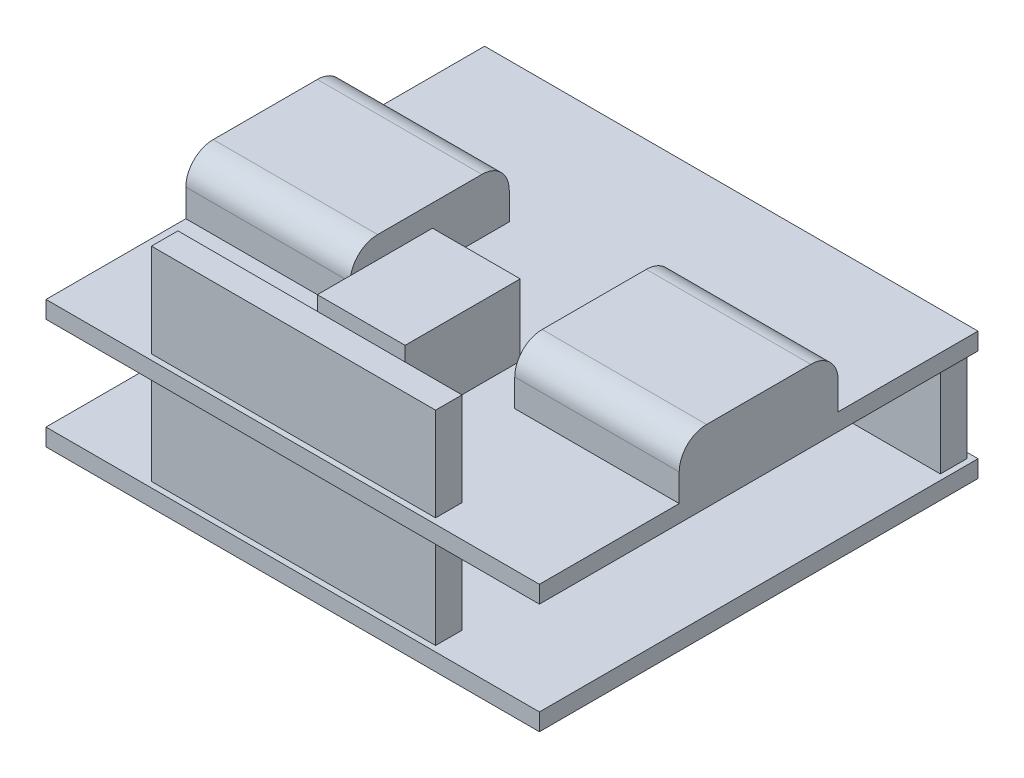
from build123d import *

# Parameters (mm, degrees)
SKETCH1_W            = 45
SKETCH1_H            = 40
BOSS_EXTRUDE1_DEPTH  = 1.57
SKETCH2_W            = 25.91
SKETCH2_H            = 2.41
BOSS_EXTRUDE2_DEPTH  = 8.51
SKETCH3_W            = 45
SKETCH3_H            = 40
BOSS_EXTRUDE3_DEPTH  = 1.57
SKETCH4_W            = 25.91
SKETCH4_H            = 2.41
BOSS_EXTRUDE4_DEPTH  = 8.51
SKETCH5_W            = 15
SKETCH5_H            = 14.5
BOSS_EXTRUDE5_DEPTH  = 5
FILLET1_R            = 2.5
FILLET1_OF_MIRROR1_R = 2.5
SKETCH6_W            = 8
SKETCH6_H            = 10.5
BOSS_EXTRUDE6_DEPTH  = 6.5


with BuildPart() as part:
    # Sketch1 → Boss-Extrude1 (new body)
    with BuildSketch(Plane(origin=(0, 0, 0), x_dir=(1, 0, 0), z_dir=(0, 1, 0))):
        Rectangle(SKETCH1_W, SKETCH1_H)
    extrude(amount=BOSS_EXTRUDE1_DEPTH)

    # Sketch2 → Boss-Extrude2 (add)
    with BuildSketch(Plane(origin=(0, 1.57, 0), x_dir=(1, 0, 0), z_dir=(0, 1, 0))):
        with Locations((9.035, 18.285)):
            Rectangle(SKETCH2_W, SKETCH2_H)
        with Locations((-0.435, -18.285)):
            Rectangle(SKETCH2_W, SKETCH2_H)
    extrude(amount=BOSS_EXTRUDE2_DEPTH)

    # Sketch3 → Boss-Extrude3 (add)
    with BuildSketch(Plane(origin=(0, 10.08, 0), x_dir=(1, 0, 0), z_dir=(0, 1, 0))):
        Rectangle(SKETCH3_W, SKETCH3_H)
    extrude(amount=BOSS_EXTRUDE3_DEPTH)

    # Sketch4 → Boss-Extrude4 (add)
    with BuildSketch(Plane(origin=(0, 11.65, 0), x_dir=(1, 0, 0), z_dir=(0, 1, 0))):
        with Locations((-0.435, -18.285)):
            Rectangle(SKETCH4_W, SKETCH4_H)
    extrude(amount=BOSS_EXTRUDE4_DEPTH)

    # Sketch5 → Boss-Extrude5 (add)
    with BuildSketch(Plane(origin=(0, 11.65, 0), x_dir=(1, 0, 0), z_dir=(0, 1, 0))):
        with Locations((-15, 0)):
            Rectangle(SKETCH5_W, SKETCH5_H)
    boss_extrude5 = extrude(amount=BOSS_EXTRUDE5_DEPTH)

    # Fillet1
    fillet1_edges = [part.edges().sort_by_distance(p)[0] for p in [
        (-15, 16.65, -7.25),
        (-15, 16.65, 7.25),
    ]]
    fillet(fillet1_edges, radius=FILLET1_R)

    # Mirror1: Boss-Extrude5 across plane
    add(boss_extrude5.mirror(Plane(origin=(0, 0, 0), x_dir=(0, 0, 1), z_dir=(1, 0, 0))))

    # Fillet1 of Mirror1
    fillet1_of_mirror1_edges = [part.edges().sort_by_distance(p)[0] for p in [
        (15, 16.65, -7.25),
        (15, 16.65, 7.25),
    ]]
    fillet(fillet1_of_mirror1_edges, radius=FILLET1_OF_MIRROR1_R)

    # Sketch6 → Boss-Extrude6 (add)
    with BuildSketch(Plane(origin=(0, 11.65, 0), x_dir=(1, 0, 0), z_dir=(0, 1, 0))):
        with Locations((0, -8.5)):
            Rectangle(SKETCH6_W, SKETCH6_H)
    extrude(amount=BOSS_EXTRUDE6_DEPTH)


solid = part.part
